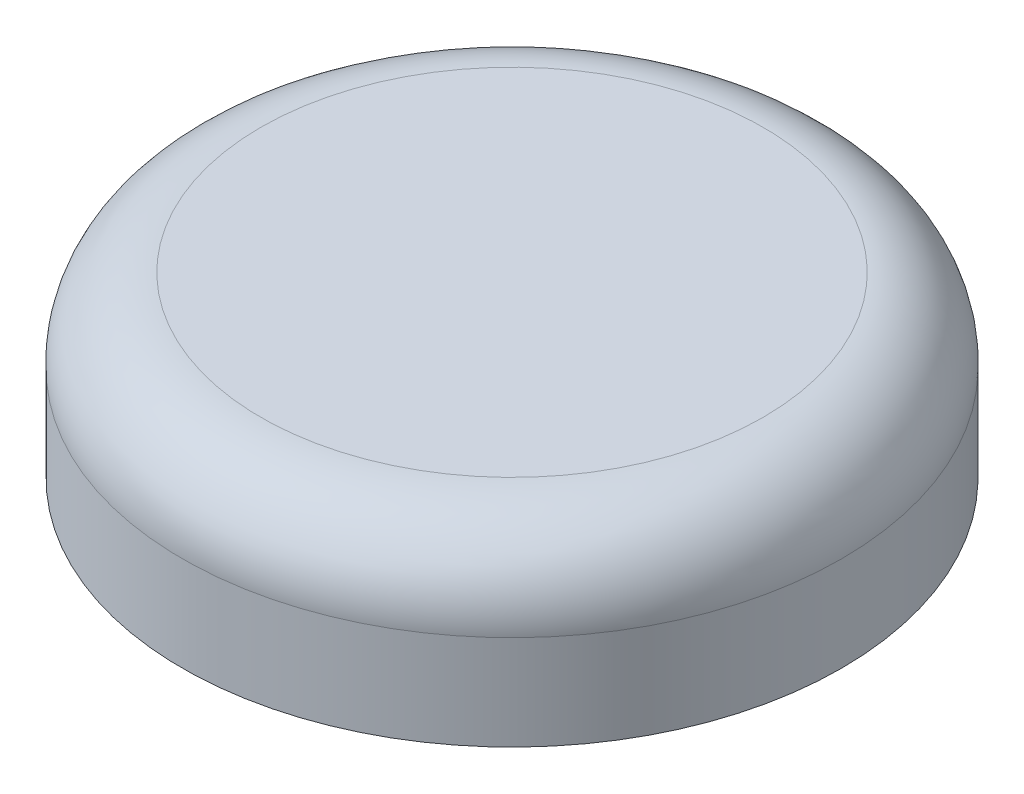
from build123d import *

# Parameters (mm, degrees)
THREAD1_PITCH = 1.5


with BuildPart() as part:
    # Sketch1 → Revolve1 (revolve)
    with BuildSketch(Plane.XY, mode=Mode.PRIVATE) as revolve1_sk:
        with BuildLine():
            Line((0, 22.425102258), (-48.030642116, 22.425102258))
            ThreePointArc((-48.030642116, 22.425102258), (-58.970806365, 17.687305053), (-63, 6.466809751))
            Line((-63, 6.466809751), (-63, -11.64773446))
            Line((-63, -11.64773446), (-60.5, -11.64773446))
            Line((-60.5, -11.64773446), (-60.5, 6.65226554))
            Line((-60.5, 6.65226554), (-59.003459594, 6.65226554))
            ThreePointArc((-59.003459594, 6.65226554), (-56.077417988, 14.925062128), (-48.030642116, 18.425102258))
            Line((-48.030642116, 18.425102258), (0, 18.425102258))
            Line((0, 18.425102258), (0, 22.425102258))
        make_face()
    revolve(revolve1_sk.sketch.rotate(Axis((0, -1000, 0), (0, 1, 0)), 180), axis=Axis((0, -1000, 0), (0, 1, 0)))

    # Thread1: the profile of Thread Profile1 profile screwed along a right-hand helix of 13.333333 turns, 8 arcs to a turn; built about Z, then put on its axis
    thread1_z = Axis((0, 0, 0), (0, 0, 1))
    thread1_corners = [(60.4997, 0, -0.000173205), (61.311898813, 0, 0.468749998), (61.311898813, 0, 0.656249998), (60.4997, 0, 1.125173201)]
    with BuildLine(mode=Mode.PRIVATE) as thread1_profile:
        Line(thread1_corners[0], thread1_corners[1])
        Line(thread1_corners[1], thread1_corners[2])
        Line(thread1_corners[2], thread1_corners[3])
        Line(thread1_corners[3], thread1_corners[0])
    thread1_cap = Face(thread1_profile.wire())
    thread1_turn_angles = [0, 22.5, 45, 67.5, 90, 112.5, 135, 157.5, 180, 202.5, 225, 247.5, 270, 292.5, 315, 337.5, 360]
    thread1_turn_weights = [1, 0.9238795325112867, 1, 0.9238795325112867, 1, 0.9238795325112867, 1, 0.9238795325112867, 1, 0.9238795325112867, 1, 0.9238795325112867, 1, 0.9238795325112867, 1, 0.9238795325112867, 1]
    thread1_turn_rails = [Edge.make_bspline([Vector(p[0], p[1], 0).rotate(thread1_z, thread1_turn_angles[k]) / thread1_turn_weights[k] + Vector(0, 0, p[2] + THREAD1_PITCH * thread1_turn_angles[k] / 360) for k in range(17)], [0, 0, 0, 1, 1, 2, 2, 3, 3, 4, 4, 5, 5, 6, 6, 7, 7, 8, 8, 8], 2, thread1_turn_weights) for p in thread1_corners]
    thread1_turn_sides = [Face.make_surface_from_curves(thread1_turn_rails[p[0]], thread1_turn_rails[p[1]]) for p in [(0, 1), (1, 2), (2, 3), (3, 0)]]
    thread1_last_angles = [4680, 4702.5, 4725, 4747.5, 4770, 4785, 4800]
    thread1_last_weights = [1, 0.9238795325112867, 1, 0.9238795325112867, 1, 0.9659258262890703, 1]
    thread1_last_rails = [Edge.make_bspline([Vector(p[0], p[1], 0).rotate(thread1_z, thread1_last_angles[k]) / thread1_last_weights[k] + Vector(0, 0, p[2] + THREAD1_PITCH * thread1_last_angles[k] / 360) for k in range(7)], [0, 0, 0, 1, 1, 2, 2, 3, 3, 3], 2, thread1_last_weights) for p in thread1_corners]
    thread1_last_sides = [Face.make_surface_from_curves(thread1_last_rails[p[0]], thread1_last_rails[p[1]]) for p in [(0, 1), (1, 2), (2, 3), (3, 0)]]
    thread1 = Plane(origin=(0, 6.65226554, 0), x_dir=(-1, 0, 0), z_dir=(0, -1, 0)) * Solid(Shell([*[p.moved(Location((0, 0, THREAD1_PITCH * i))) for i in range(13) for p in thread1_turn_sides], *thread1_last_sides, thread1_cap, thread1_cap.rotate(thread1_z, 4800).moved(Location((0, 0, THREAD1_PITCH * 4800 / 360)))]))
    add(thread1, mode=Mode.SUBTRACT)


solid = part.part
